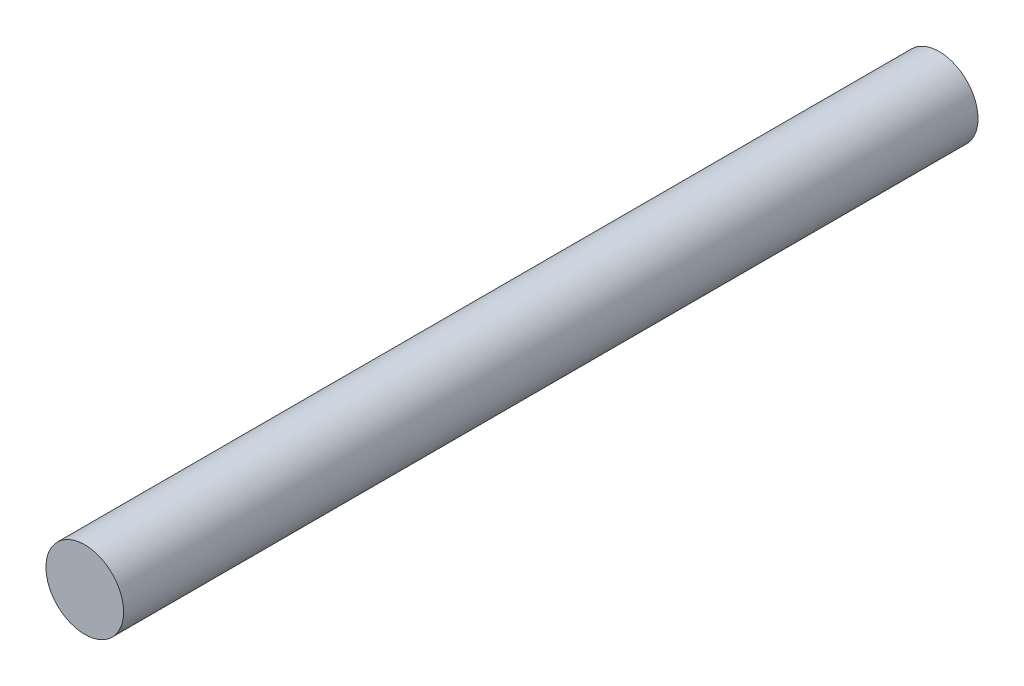
from build123d import *

# Parameters (mm, degrees)
SKETCH1_R = 4
ROD_DEPTH = 88


with BuildPart() as part:
    # Sketch1 → Rod (new body)
    with BuildSketch(Plane.XY):
        Circle(SKETCH1_R)
    extrude(amount=ROD_DEPTH)


solid = part.part
